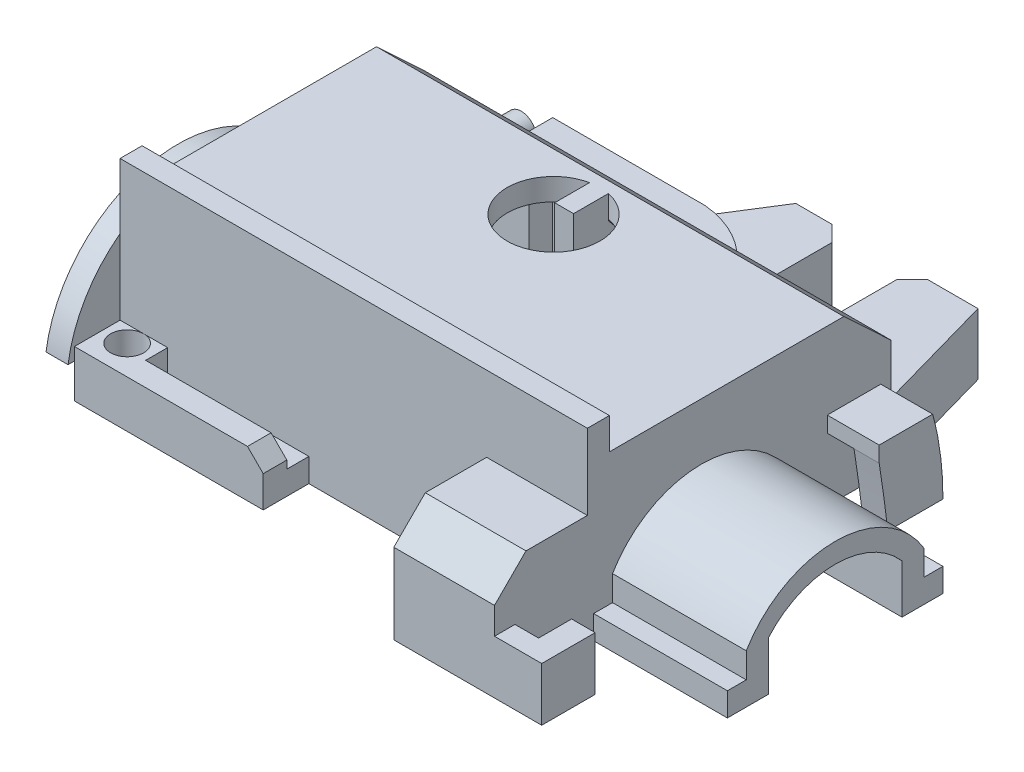
from build123d import *

# Parameters (mm, degrees)
SKETCH1_W            = 29.7
SKETCH1_H            = 19.3
BOSS_EXTRUDE1_DEPTH  = 9.9
SKETCH2_W            = 23.1
SKETCH2_H            = 3.9
BOSS_EXTRUDE3_DEPTH  = 7.7
CUT_EXTRUDE1_DEPTH   = 24.612390815
BOSS_EXTRUDE4_DEPTH  = 3.2
BOSS_EXTRUDE5_DEPTH  = 3.9
SKETCH7_R            = 0.95
BOSS_EXTRUDE6_DEPTH  = 2.9
BOSS_EXTRUDE8_DEPTH  = 8.5
SKETCH10_W           = 12
SKETCH10_H           = 3
BOSS_EXTRUDE9_DEPTH  = 2.9
SKETCH11_W           = 8.976509782
SKETCH11_H           = 1.4
CUT_EXTRUDE2_DEPTH   = 1.5
SKETCH14_R           = 1.05
CUT_EXTRUDE3_DEPTH   = 30.897407914
SKETCH15_W           = 6.4
SKETCH15_H           = 7.1
BOSS_EXTRUDE10_DEPTH = 5.9
SKETCH16_W           = 1.3
SKETCH16_H           = 3.4
BOSS_EXTRUDE11_DEPTH = 3
SKETCH17_W           = 3.4
SKETCH17_H           = 3.4
BOSS_EXTRUDE12_DEPTH = 1.5
BOSS_EXTRUDE13_DEPTH = 2.2
BOSS_EXTRUDE15_DEPTH = 1.4
SKETCH21_W           = 29.7
SKETCH21_H           = 1.4
BOSS_EXTRUDE16_DEPTH = 2
SHELL1_OUTLINE_W     = 26.9
SHELL1_OUTLINE_H     = 16.5
SHELL1_DEPTH         = 8.5
SHELL1_2_OUTLINE_W   = 3.6
SHELL1_2_OUTLINE_H   = 5.9
SHELL1_2_DEPTH       = 2.5
SHELL1_START         = 2.5
SHELL1_3_OUTLINE_W   = 3.6
SHELL1_3_OUTLINE_H   = 5.9
SHELL1_3_DEPTH       = 3.2
SHELL1_4_DEPTH       = 0.1
SHELL1_START_2       = 0.1
SHELL1_5_DEPTH       = 1.5
CUT_EXTRUDE5_START   = -2
CUT_EXTRUDE5_DEPTH   = 2
CUT_EXTRUDE6_DEPTH   = 2
BOSS_EXTRUDE17_DEPTH = 3.3
SKETCH26_W           = 1.7
SKETCH26_H           = 3.040173169
CUT_EXTRUDE8_DEPTH   = 4
SKETCH32_R           = 1.35
SKETCH32_R_2         = 0.85
BOSS_EXTRUDE22_DEPTH = 5.7
SKETCH33_R           = 1.35
SKETCH33_R_2         = 0.85
BOSS_EXTRUDE23_DEPTH = 2.5
SKETCH34_R           = 1.2
SKETCH34_R_2         = 0.7
BOSS_EXTRUDE24_DEPTH = 8.5
SKETCH35_R           = 2.95
CUT_EXTRUDE9_DEPTH   = 4
CHAMFER1_SIZE2       = 3
CHAMFER1_SIZE        = 2.8
CHAMFER2_SIZE        = 1
CHAMFER3_SIZE        = 1
CHAMFER4_SIZE        = 2
SKETCH36_W           = 1.2
SKETCH36_H           = 6.025951521
BOSS_EXTRUDE25_DEPTH = 3.2
BOSS_EXTRUDE33_START = -4.2
BOSS_EXTRUDE33_DEPTH = 4.2
BOSS_EXTRUDE36_DEPTH = 2.5
CHAMFER5_SIZE        = 2.2
CHAMFER5_SIZE_2      = 2.7
CHAMFER6_SIZE        = 2.7
CHAMFER6_SIZE2       = 2.2


with BuildPart() as part:
    # Sketch1 → Boss-Extrude1 (new body)
    with BuildSketch(Plane(origin=(0, 0, 0), x_dir=(1, 0, 0), z_dir=(0, 1, 0))):
        Rectangle(SKETCH1_W, SKETCH1_H)
    extrude(amount=BOSS_EXTRUDE1_DEPTH)

    # Sketch2 → Boss-Extrude3 (add)
    with BuildSketch(Plane(origin=(0, 0, -9.65), x_dir=(-1, 0, 0), z_dir=(0, 0, -1))):
        with Locations((-3.3, 1.95)):
            Rectangle(SKETCH2_W, SKETCH2_H)
    extrude(amount=BOSS_EXTRUDE3_DEPTH)

    # Sketch4 → Cut-Extrude1 (cut, through all)
    with BuildSketch(Plane(origin=(0, 3.9, 0), x_dir=(1, 0, 0), z_dir=(0, 1, 0))):
        with BuildLine():
            Line((8.5, 12.25), (8.5, 17.35))
            Line((8.5, 17.35), (4.4, 17.35))
            Line((4.4, 17.35), (4.4, 12.25))
            ThreePointArc((4.4, 12.25), (6.45, 10.2), (8.5, 12.25))
        make_face()
        Polygon((14.85, 9.65), (12.679746559, 17.35), (14.85, 17.35), align=None)
        Polygon((1.1, 17.35), (-3.75, 9.65), (-8.25, 9.65), (-8.25, 17.35), align=None)
    extrude(amount=-CUT_EXTRUDE1_DEPTH, mode=Mode.SUBTRACT)

    # Sketch5 → Boss-Extrude4 (add)
    with BuildSketch(Plane(origin=(0, 3.9, 0), x_dir=(1, 0, 0), z_dir=(0, 1, 0))):
        with BuildLine():
            Line((-8.15, 9.65), (5.05, 9.65))
            ThreePointArc((5.05, 9.65), (3.409161026, 10.676894337), (1.53218592, 11.15))
            Line((1.53218592, 11.15), (-8.15, 11.15))
            Line((-8.15, 11.15), (-8.15, 9.65))
        make_face()
    extrude(amount=BOSS_EXTRUDE4_DEPTH)

    # Sketch6 → Boss-Extrude5 (add)
    with BuildSketch(Plane.XZ.offset(-3.9)):
        Polygon((-8.15, -9.65), (-8.15, -11.15), (-2.805194805, -11.15), (-3.75, -9.65), align=None)
    extrude(amount=BOSS_EXTRUDE5_DEPTH)

    # Sketch7 → Boss-Extrude6 (add)
    with BuildSketch(Plane(origin=(0, 0, -9.65), x_dir=(-1, 0, 0), z_dir=(0, 0, -1))):
        with Locations(Location((11.55, 4.1, 0), (0, 0, 180))):
            Circle(SKETCH7_R)
    extrude(amount=BOSS_EXTRUDE6_DEPTH)

    # Sketch8 → Boss-Extrude8 (add)
    with BuildSketch(Plane(origin=(14.85, 0, 0), x_dir=(0, 0, -1), z_dir=(1, 0, 0))):
        with BuildLine():
            Line((4.45, 0), (1.85, 0))
            Line((1.85, 0), (1.85, 1.5))
            Line((1.85, 1.5), (1.85, 3.1))
            ThreePointArc((1.85, 3.1), (-2.4, 5.040092727), (-6.65, 3.1))
            Line((-6.65, 3.1), (-6.65, 1.5))
            Line((-6.65, 1.5), (-6.65, 0))
            Line((-6.65, 0), (-9.25, 0))
            Line((-9.25, 0), (-9.25, 1.5))
            Line((-9.25, 1.5), (-8.05, 1.5))
            Line((-8.05, 1.5), (-8.05, 3.1))
            ThreePointArc((-8.05, 3.1), (-2.4, 6.300419583), (3.25, 3.1))
            Line((3.25, 3.1), (3.25, 1.5))
            Line((3.25, 1.5), (4.45, 1.5))
            Line((4.45, 1.5), (4.45, 0))
        make_face()
    extrude(amount=BOSS_EXTRUDE8_DEPTH)

    # Sketch10 → Boss-Extrude9 (add)
    with BuildSketch(Plane.XY.offset(9.65)):
        with Locations((-8.85, 1.5)):
            Rectangle(SKETCH10_W, SKETCH10_H)
    extrude(amount=BOSS_EXTRUDE9_DEPTH)

    # Sketch11 → Cut-Extrude2 (cut)
    with BuildSketch(Plane(origin=(0, 3, 0), x_dir=(1, 0, 0), z_dir=(0, 1, 0))):
        with Locations((-7.338254891, -10.35)):
            Rectangle(SKETCH11_W, SKETCH11_H)
    extrude(amount=-CUT_EXTRUDE2_DEPTH, mode=Mode.SUBTRACT)

    # Sketch14 → Cut-Extrude3 (cut, through all)
    with BuildSketch(Plane(origin=(0, 3, 0), x_dir=(1, 0, 0), z_dir=(0, 1, 0))):
        with Locations(Location((-13.35, -10.7, 0), (0, 0, 270))):
            Circle(SKETCH14_R)
    extrude(amount=-CUT_EXTRUDE3_DEPTH, mode=Mode.SUBTRACT)

    # Sketch15 → Boss-Extrude10 (add)
    with BuildSketch(Plane.XY.offset(9.65)):
        with Locations((11.65, 3.55)):
            Rectangle(SKETCH15_W, SKETCH15_H)
    extrude(amount=BOSS_EXTRUDE10_DEPTH)

    # Sketch16 → Boss-Extrude11 (add)
    with BuildSketch(Plane(origin=(14.85, 0, 0), x_dir=(0, 0, -1), z_dir=(1, 0, 0))):
        with Locations((-14.9, 1.7)):
            Rectangle(SKETCH16_W, SKETCH16_H)
    extrude(amount=BOSS_EXTRUDE11_DEPTH)

    # Sketch17 → Boss-Extrude12 (add)
    with BuildSketch(Plane(origin=(17.85, 0, 0), x_dir=(0, 0, -1), z_dir=(1, 0, 0))):
        with Locations((-13.85, 1.7)):
            Rectangle(SKETCH17_W, SKETCH17_H)
    extrude(amount=-BOSS_EXTRUDE12_DEPTH)

    # Sketch19 → Boss-Extrude13 (add)
    with BuildSketch(Plane.ZY.offset(14.85)):
        with BuildLine():
            Line((-2.010663216, 0), (-0.703520417, 0))
            ThreePointArc((-0.703520417, 0), (2.373239791, 2.090978922), (5.45, 0))
            Line((5.45, 0), (6.757142799, 0))
            ThreePointArc((6.757142799, 0), (2.373239791, 3.331847949), (-2.010663216, 0))
        make_face()
    extrude(amount=BOSS_EXTRUDE13_DEPTH)

    # Sketch20 → Boss-Extrude15 (add)
    with BuildSketch(Plane.ZY.offset(17.05)):
        with BuildLine():
            ThreePointArc((10.757142799, 0), (2.373239791, 7.253785393), (-6.010663216, 0))
            Line((-6.010663216, 0), (-2.010663216, 0))
            Line((-2.010663216, 0), (-0.703520417, 0))
            ThreePointArc((-0.703520417, 0), (2.373239791, 2.090978922), (5.45, 0))
            Line((5.45, 0), (6.757142799, 0))
            Line((6.757142799, 0), (10.757142799, 0))
        make_face()
    extrude(amount=BOSS_EXTRUDE15_DEPTH)

    # Sketch21 → Boss-Extrude16 (add)
    with BuildSketch(Plane(origin=(0, 9.9, 0), x_dir=(1, 0, 0), z_dir=(0, 1, 0))):
        with Locations((0, -8.95)):
            Rectangle(SKETCH21_W, SKETCH21_H)
    extrude(amount=BOSS_EXTRUDE16_DEPTH)

    # Shell1: read off the stored shape, not the designer's step
    # Shell1 outline → Shell1 (cut)
    with BuildSketch(Plane(origin=(0, 0, 0), x_dir=(1, 0, 0), z_dir=(0, 1, 0))):
        Rectangle(SHELL1_OUTLINE_W, SHELL1_OUTLINE_H)
    extrude(amount=SHELL1_DEPTH, mode=Mode.SUBTRACT)

    # Shell1 2 outline → Shell1 2 (cut)
    with BuildSketch(Plane(origin=(0, 0, 0), x_dir=(1, 0, 0), z_dir=(0, 1, 0))):
        with Locations((11.65, -11.2)):
            Rectangle(SHELL1_2_OUTLINE_W, SHELL1_2_OUTLINE_H)
        with BuildLine():
            Line((13.45, 8.25), (13.45, 9.456474215))
            Line((13.45, 9.456474215), (11.619792639, 15.95))
            Line((11.619792639, 15.95), (9.9, 15.95))
            Line((9.9, 15.95), (9.9, 12.25))
            ThreePointArc((9.9, 12.25), (6.45, 8.8), (3, 12.25))
            Line((3, 12.25), (3, 15.95))
            Line((3, 15.95), (1.872752248, 15.95))
            Line((1.872752248, 15.95), (-2.032442558, 9.75))
            Line((-2.032442558, 9.75), (-6.75, 9.75))
            Line((-6.75, 9.75), (-6.75, 8.25))
            Line((-6.75, 8.25), (13.45, 8.25))
        make_face()
    extrude(amount=SHELL1_2_DEPTH, mode=Mode.SUBTRACT)

    # Shell1 3 outline → Shell1 3 (cut)
    with BuildSketch(Plane(origin=(0, 0, 0), x_dir=(1, 0, 0), z_dir=(0, 1, 0)).offset(SHELL1_START)):
        with Locations((11.65, -11.2)):
            Rectangle(SHELL1_3_OUTLINE_W, SHELL1_3_OUTLINE_H)
        with BuildLine():
            Line((-6.75, 8.25), (4.488078335, 8.25))
            ThreePointArc((4.488078335, 8.25), (3.111788225, 9.273075846), (1.464547501, 9.75))
            Line((1.464547501, 9.75), (-6.75, 9.75))
            Line((-6.75, 9.75), (-6.75, 8.25))
        make_face()
    extrude(amount=SHELL1_3_DEPTH, mode=Mode.SUBTRACT)

    # Shell1 4 outline → Shell1 4 (cut)
    with BuildSketch(Plane(origin=(0, 0, 0), x_dir=(1, 0, 0), z_dir=(0, 1, 0))):
        with BuildLine():
            Line((-4.25, -11.15), (-4.25, -8.25))
            Line((-4.25, -8.25), (-13.35, -8.25))
            ThreePointArc((-13.35, -8.25), (-11.465192318, -9.134752416), (-10.941681084, -11.15))
            Line((-10.941681084, -11.15), (-4.25, -11.15))
        make_face()
        with BuildLine():
            ThreePointArc((-13.45, -8.252041667), (-13.40001042, -8.25051047), (-13.35, -8.25))
            Line((-13.35, -8.25), (-13.45, -8.25))
            Line((-13.45, -8.25), (-13.45, -8.252041667))
        make_face()
    extrude(amount=SHELL1_4_DEPTH, mode=Mode.SUBTRACT)

    # Shell1 5 outline → Shell1 5 (cut)
    with BuildSketch(Plane(origin=(0, 0, 0), x_dir=(1, 0, 0), z_dir=(0, 1, 0)).offset(SHELL1_START_2)):
        with BuildLine():
            Line((-13.226509782, -8.25311419), (-13.226509782, -8.25))
            Line((-13.226509782, -8.25), (-13.35, -8.25))
            ThreePointArc((-13.35, -8.25), (-13.288235261, -8.250778671), (-13.226509782, -8.25311419))
        make_face()
        with BuildLine():
            ThreePointArc((-13.45, -8.252041667), (-13.40001042, -8.25051047), (-13.35, -8.25))
            Line((-13.35, -8.25), (-13.45, -8.25))
            Line((-13.45, -8.25), (-13.45, -8.252041667))
        make_face()
    extrude(amount=SHELL1_5_DEPTH, mode=Mode.SUBTRACT)

    # Sketch23 → Cut-Extrude5 (cut)
    with BuildSketch(Plane.ZY.offset(14.85).offset(CUT_EXTRUDE5_START)):
        with BuildLine():
            Line((-0.703520417, 0), (5.45, 0))
            ThreePointArc((5.45, 0), (2.373239791, 2.090978922), (-0.703520417, 0))
        make_face()
    extrude(amount=CUT_EXTRUDE5_DEPTH, mode=Mode.SUBTRACT)

    # Sketch24 → Cut-Extrude6 (cut)
    with BuildSketch(Plane(origin=(14.85, 0, 0), x_dir=(0, 0, -1), z_dir=(1, 0, 0))):
        with BuildLine():
            Line((-4.55, 0), (-0.15, 0))
            ThreePointArc((-0.15, 0), (-2.35, 1.430488878), (-4.55, 0))
        make_face()
    extrude(amount=-CUT_EXTRUDE6_DEPTH, mode=Mode.SUBTRACT)

    # Sketch25 → Boss-Extrude17 (add)
    with BuildSketch(Plane(origin=(14.85, 0, 0), x_dir=(0, 0, -1), z_dir=(1, 0, 0))):
        with BuildLine():
            Line((9.65, 0), (6.15, 0))
            add(Edge.make_bspline(
                [(5.6, 4), (5.912494259, 2.005178445), (6.15, 0)],
                knots=[0, 0, 0, 1, 1, 1], degree=2))
            Line((5.6, 4), (5.6, 5))
            Line((5.6, 5), (9, 5))
            add(Edge.make_bspline(
                [(9, 5), (9.662826285, 2.545299606), (9.65, 0)],
                knots=[0, 0, 0, 1, 1, 1], degree=2))
        make_face()
    extrude(amount=BOSS_EXTRUDE17_DEPTH)

    # Sketch26 → Cut-Extrude8 (cut)
    with BuildSketch(Plane.XZ):
        with Locations((15.7, -6.629913416)):
            Rectangle(SKETCH26_W, SKETCH26_H)
    extrude(amount=-CUT_EXTRUDE8_DEPTH, mode=Mode.SUBTRACT)

    # Sketch32 → Boss-Extrude22 (add)
    with BuildSketch(Plane.XZ.offset(-5.7)):
        with Locations(Location((11.665452924, 9.6, 0), (0, 0, 90))):
            Circle(SKETCH32_R)
        with Locations(Location((11.665452924, 9.6, 0), (0, 0, 90))):
            Circle(SKETCH32_R_2, mode=Mode.SUBTRACT)
    extrude(amount=BOSS_EXTRUDE22_DEPTH)

    # Sketch33 → Boss-Extrude23 (add)
    with BuildSketch(Plane.XZ.offset(-2.5)):
        with Locations(Location((11.342898785, -11.75, 0), (0, 0, 90))):
            Circle(SKETCH33_R)
        with Locations(Location((11.342898785, -11.75, 0), (0, 0, 90))):
            Circle(SKETCH33_R_2, mode=Mode.SUBTRACT)
    extrude(amount=BOSS_EXTRUDE23_DEPTH)

    # Sketch34 → Boss-Extrude24 (add)
    with BuildSketch(Plane.XZ.offset(-8.5)):
        with Locations(Location((-12.21310403, -6.709558041, 0), (0, 0, 90))):
            Circle(SKETCH34_R)
        with Locations(Location((-12.21310403, -6.709558041, 0), (0, 0, 90))):
            Circle(SKETCH34_R_2, mode=Mode.SUBTRACT)
    extrude(amount=BOSS_EXTRUDE24_DEPTH)

    # Sketch35 → Cut-Extrude9 (cut)
    with BuildSketch(Plane.XZ.offset(-8.5)):
        with Locations(Location((0, -3.05, 0), (0, 0, 270))):
            Circle(SKETCH35_R)
    extrude(amount=-CUT_EXTRUDE9_DEPTH, mode=Mode.SUBTRACT)

    # Chamfer1
    chamfer1_edges = [part.edges().sort_by_distance(p)[0] for p in [
        (0, 9.9, -9.65),
    ]]
    chamfer1_side = [part.faces().sort_by_distance(p)[0] for p in [
        (0, 9.844, -9.65),
    ]]
    chamfer(chamfer1_edges, length=CHAMFER1_SIZE - 0.0001, length2=CHAMFER1_SIZE2 - 0.0001, reference=chamfer1_side[0])  # a hair under: the kernel refuses the full size

    # Chamfer2
    chamfer2_edges = [part.edges().sort_by_distance(p)[0] for p in [
        (4.4, 1.95, -17.35),
        (8.5, 1.95, -17.35),
    ]]
    chamfer(chamfer2_edges, length=CHAMFER2_SIZE)

    # Chamfer3
    chamfer3_edges = [part.edges().sort_by_distance(p)[0] for p in [
        (-2.85, 3, 11.8),
    ]]
    chamfer(chamfer3_edges, length=CHAMFER3_SIZE)

    # Chamfer4
    chamfer4_edges = [part.edges().sort_by_distance(p)[0] for p in [
        (11.65, 7.1, 15.55),
    ]]
    chamfer(chamfer4_edges, length=CHAMFER4_SIZE)

    # Sketch36 → Boss-Extrude25 (add)
    with BuildSketch(Plane.XZ.offset(-2.5)):
        with Locations((0, -6.73702424)):
            Rectangle(SKETCH36_W, SKETCH36_H)
    extrude(amount=-BOSS_EXTRUDE25_DEPTH)

    # Sketch39 → Boss-Extrude33 (add)
    with BuildSketch(Plane(origin=(0, 9.9, 0), x_dir=(1, 0, 0), z_dir=(0, 1, 0)).offset(BOSS_EXTRUDE33_START)):
        with BuildLine():
            Line((-0.6, 3.724048479), (0.6, 3.724048479))
            Line((0.6, 3.724048479), (0.6, 5.938338623))
            ThreePointArc((0.6, 5.938338623), (0, 6), (-0.6, 5.938338623))
            Line((-0.6, 5.938338623), (-0.6, 3.724048479))
        make_face()
    extrude(amount=BOSS_EXTRUDE33_DEPTH)

    # Sketch42 → Boss-Extrude36 (add)
    with BuildSketch(Plane.XZ.offset(-2.5)):
        Polygon((0.6, -12.012795022), (0.6, -13.908363861), (-0.6, -12.012795022), (-0.6, -3.724048479), (0.6, -3.724048479), align=None)
    extrude(amount=BOSS_EXTRUDE36_DEPTH)

    # Chamfer5
    # the kernel refuses this chamfer: 2.7, 2.2 mm, written as the material it adds along each edge
    with BuildSketch(Plane(origin=(13.45, 8.5, -8.25), x_dir=(0, 0, 1), z_dir=(-1, 0, 0))) as chamfer5_piece_1_section:
        Polygon((CHAMFER5_SIZE, 0), (0, -CHAMFER5_SIZE_2), (0, 0), align=None)
    chamfer5_piece_1 = extrude(amount=26.9, mode=Mode.PRIVATE)
    chamfer5_piece_1 = split(chamfer5_piece_1, bisect_by=Plane(origin=(13.45, 8.450170436, -8.203492517), z_dir=(0, -0.7310560786244812, 0.6823173820929644)), keep=Keep.TOP, mode=Mode.PRIVATE)
    chamfer5_piece_1 = chamfer5_piece_1 - Plane(origin=(-12.21310403, 8.5, -6.709558041), x_dir=(0, 0, 1), z_dir=(0, 1, 0)) * Cylinder(0.7, 65, mode=Mode.PRIVATE)
    add(chamfer5_piece_1)

    # Chamfer6
    chamfer6_edges = [part.edges().sort_by_distance(p)[0] for p in [
        (0, 5.7, -6),
    ]]
    chamfer6_side = [part.faces().sort_by_distance(p)[0] for p in [
        (0, 7.1, -6),
    ]]
    chamfer(chamfer6_edges, length=CHAMFER6_SIZE, length2=CHAMFER6_SIZE2, reference=chamfer6_side[0])


solid = part.part
